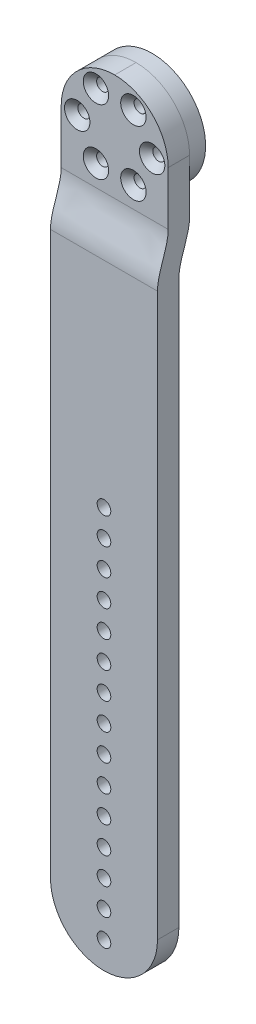
from build123d import *

# Parameters (mm, degrees)
SKETCH7_W           = 40
SKETCH7_H           = 40
BOSS_EXTRUDE1_DEPTH = 14
LOFT1_START         = -20
LOFT1_DEPTH         = 40
SKETCH16_W          = 49.026286786
SKETCH16_H          = 65.242270374
SKETCH16_R          = 20
CUT_EXTRUDE3_DEPTH  = 6
SKETCH17_W          = 40
SKETCH17_H          = 8
BOSS_EXTRUDE5_DEPTH = 230
SKETCH10_R          = 2.25
CUT_EXTRUDE1_DEPTH  = 25
CHAMFER1_SIZE       = 2.5
FILLET3_R           = 20
FILLET4_R           = 20
SKETCH41_R          = 2.55
CUT_EXTRUDE4_DEPTH  = 20
LPATTERN1_COUNT     = 15
LPATTERN1_PITCH     = 10


# Read off the part's stored shape, not the designer's step: Loft1
with BuildPart() as part:
    # Sketch7 → Boss-Extrude1 (new body)
    with BuildSketch(Plane.XY):
        Rectangle(SKETCH7_W, SKETCH7_H)
    extrude(amount=BOSS_EXTRUDE1_DEPTH)

    # Loft1 outline → Loft1 (add)
    with BuildSketch(Plane.YZ.offset(LOFT1_START)):
        with BuildLine():
            add(Edge.make_bspline(
                [(-38, 18), (-31.853637028, 18), (-26.146362972, 14), (-20, 14)],
                knots=[0, 0, 0, 0, 1, 1, 1, 1], degree=3))
            Line((-38, 18), (-38, 10))
            add(Edge.make_bspline(
                [(-38, 10), (-31.853637028, 10), (-26.146362972, 6), (-20, 6)],
                knots=[0, 0, 0, 0, 1, 1, 1, 1], degree=3))
            Line((-20, 6), (-20, 14))
        make_face()
    extrude(amount=LOFT1_DEPTH)

    # Sketch16 → Cut-Extrude3 (cut)
    with BuildSketch(Plane(origin=(0, 0, 0), x_dir=(-1, 0, 0), z_dir=(0, 0, -1))):
        Rectangle(SKETCH16_W, SKETCH16_H)
        Circle(SKETCH16_R, mode=Mode.SUBTRACT)
    extrude(amount=-CUT_EXTRUDE3_DEPTH, mode=Mode.SUBTRACT)

    # Sketch17 → Boss-Extrude5 (add)
    with BuildSketch(Plane(origin=(0, -38, 0), x_dir=(-1, 0, 0), z_dir=(0, -1, 0))):
        with Locations((0, -14)):
            Rectangle(SKETCH17_W, SKETCH17_H)
    extrude(amount=BOSS_EXTRUDE5_DEPTH)

    # Sketch10 → Cut-Extrude1 (cut)
    with BuildSketch(Plane.XY.offset(14)):
        with Locations((-7.00009521, 12.124420806)):
            Circle(SKETCH10_R)
        with Locations((6.99990479, 12.124420806)):
            Circle(SKETCH10_R)
        with Locations((13.99990479, 6.5153e-05)):
            Circle(SKETCH10_R)
        with Locations((6.99990479, -12.1242905)):
            Circle(SKETCH10_R)
        with Locations((-7.00009521, -12.1242905)):
            Circle(SKETCH10_R)
        with Locations((-14.00009521, 6.5153e-05)):
            Circle(SKETCH10_R)
    extrude(amount=-CUT_EXTRUDE1_DEPTH, mode=Mode.SUBTRACT)

    # Chamfer1
    chamfer1_edges = [part.edges().sort_by_distance(p)[0] for p in [
        (4.74990479, 12.124420806, 14),
        (-9.25009521, 12.124420806, 14),
        (-16.25009521, 6.5153e-05, 14),
        (-9.25009521, -12.1242905, 14),
        (4.74990479, -12.1242905, 14),
        (11.74990479, 6.5153e-05, 14),
    ]]
    chamfer(chamfer1_edges, length=CHAMFER1_SIZE)

    # Fillet3
    fillet3_edges = [part.edges().sort_by_distance(p)[0] for p in [
        (20, 20, 10),
        (-20, 20, 10),
    ]]
    fillet(fillet3_edges, radius=FILLET3_R - 0.0001)  # a hair under: the kernel refuses the full size

    # Fillet4
    fillet4_edges = [part.edges().sort_by_distance(p)[0] for p in [
        (-20, -268, 14),
        (20, -268, 14),
    ]]
    fillet(fillet4_edges, radius=FILLET4_R - 0.0001)  # a hair under: the kernel refuses the full size

    # Sketch41 → Cut-Extrude4 (cut)
    with BuildSketch(Plane.XY):
        with Locations(Location((0, -258, 0), (0, 0, 180))):
            Circle(SKETCH41_R)
    cut_extrude4 = extrude(amount=CUT_EXTRUDE4_DEPTH, mode=Mode.SUBTRACT)

    # LPattern1: Cut-Extrude4 ×15
    with Locations(*[(0, i * LPATTERN1_PITCH, 0) for i in range(1, LPATTERN1_COUNT)]):
        add(cut_extrude4, mode=Mode.SUBTRACT)


solid = part.part
